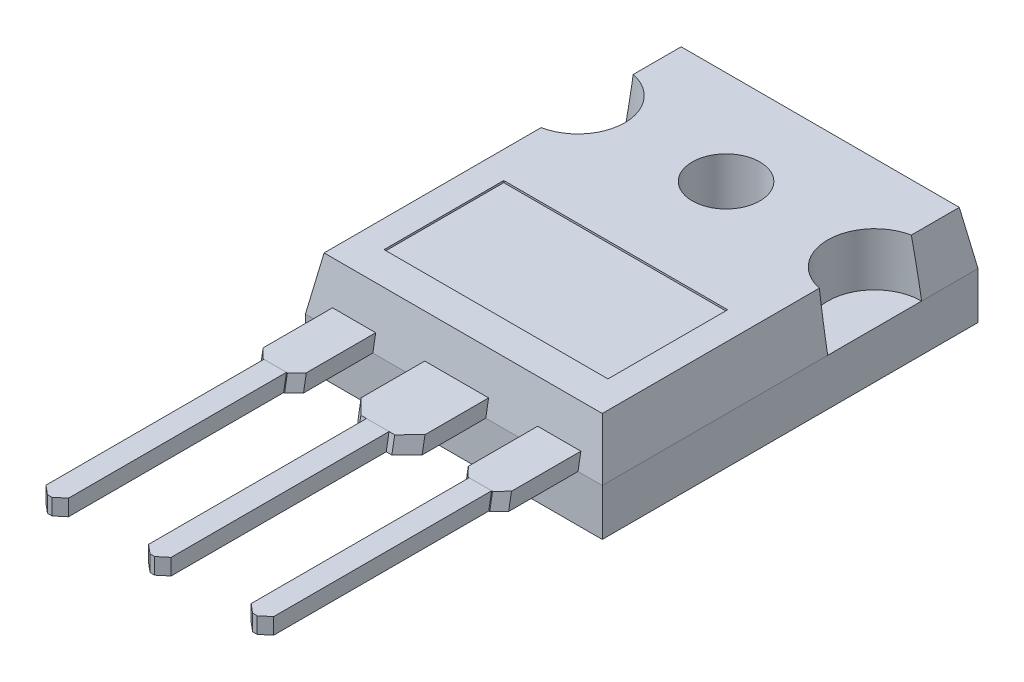
from build123d import *
from OCP.BRepFilletAPI import BRepFilletAPI_MakeChamfer

# Parameters (mm, degrees)
SKETCH1_W             = 15.8
SKETCH1_H             = 20
BOSS_EXTRUDE1_DEPTH   = 2.49
SKETCH2_W             = 15.8
SKETCH2_H             = 20
BOSS_EXTRUDE3_DEPTH   = 2.82
BOSS_EXTRUDE3_TAPER   = 10
BOSS_EXTRUDE4_START   = -1.7
BOSS_EXTRUDE4_DEPTH   = 3.4
BOSS_EXTRUDE4_START_2 = -6.61
BOSS_EXTRUDE4_2_DEPTH = 2.3
BOSS_EXTRUDE4_START_3 = 4.31
BOSS_EXTRUDE4_3_DEPTH = 2.3
BOSS_EXTRUDE6_START   = 14.04836
SKETCH5_W             = 1.2
SKETCH5_H             = 0.86
BOSS_EXTRUDE6_DEPTH   = 12
BOSS_EXTRUDE6_2_DEPTH = 12
BOSS_EXTRUDE6_3_DEPTH = 12
SKETCH6_R             = 1.8
CUT_EXTRUDE1_DEPTH    = 28.733069795
SKETCH7_R             = 2.5
CUT_EXTRUDE2_DEPTH    = 2.82
CHAMFER2_SIZE         = 0.5
CHAMFER3_SIZE         = 0.8
CHAMFER7_SIZE         = 0.4
CHAMFER7_SIZE2        = 0.476701437
CHAMFER8_SIZE         = 0.4
CHAMFER8_SIZE2        = 0.476701437
CHAMFER9_SIZE         = 0.4
CHAMFER9_SIZE2        = 0.476701437
SKETCH9_W             = 12.986336946
SKETCH9_H             = 15.440559179
CUT_EXTRUDE3_DEPTH    = 2.49
SKETCH10_W            = 12.986336946
SKETCH10_H            = 15.440559179
BOSS_EXTRUDE7_DEPTH   = 2.49
SKETCH13_R            = 1.8
CUT_EXTRUDE4_DEPTH    = 2.49
SKETCH14_W            = 11.919281888
SKETCH14_H            = 6.372610916
CUT_EXTRUDE5_DEPTH    = 0.1


# Read off the part's stored shape, not the designer's step: Boss-Extrude4
with BuildPart() as part:
    # Sketch1 → Boss-Extrude1 (new body)
    with BuildSketch(Plane(origin=(0, 0, 0), x_dir=(1, 0, 0), z_dir=(0, 1, 0))):
        Rectangle(SKETCH1_W, SKETCH1_H)
    extrude(amount=BOSS_EXTRUDE1_DEPTH)

    # Sketch2 → Boss-Extrude3 (add)
    with BuildSketch(Plane(origin=(0, 2.49, 0), x_dir=(1, 0, 0), z_dir=(0, 1, 0))):
        Rectangle(SKETCH2_W, SKETCH2_H)
    extrude(amount=BOSS_EXTRUDE3_DEPTH, taper=BOSS_EXTRUDE3_TAPER)

    # Boss-Extrude4 outline → Boss-Extrude4 (add)
    with BuildSketch(Plane.YZ.offset(BOSS_EXTRUDE4_START)):
        Polygon((2.49, 10), (3.35, 9.848358796), (3.35, 14.048358797), (2.49, 14.2), align=None)
    extrude(amount=BOSS_EXTRUDE4_DEPTH)

    # Boss-Extrude4 2 outline → Boss-Extrude4 2 (add)
    with BuildSketch(Plane.YZ.offset(BOSS_EXTRUDE4_START_2)):
        Polygon((2.49, 10), (3.35, 9.848358796), (3.35, 14.048358797), (2.49, 14.2), align=None)
    extrude(amount=BOSS_EXTRUDE4_2_DEPTH)

    # Boss-Extrude4 3 outline → Boss-Extrude4 3 (add)
    with BuildSketch(Plane.YZ.offset(BOSS_EXTRUDE4_START_3)):
        Polygon((2.49, 10), (3.35, 9.848358796), (3.35, 14.048358797), (2.49, 14.2), align=None)
    extrude(amount=BOSS_EXTRUDE4_3_DEPTH)

    # Sketch6 → Cut-Extrude1 (cut, through all)
    with BuildSketch(Plane(origin=(0, 5.31, 0), x_dir=(1, 0, 0), z_dir=(0, 1, 0))):
        with Locations(Location((0, 4.49, 0), (0, 0, 270))):
            Circle(SKETCH6_R)
    extrude(amount=-CUT_EXTRUDE1_DEPTH, mode=Mode.SUBTRACT)

    # Sketch7 → Cut-Extrude2 (cut)
    with BuildSketch(Plane(origin=(0, 5.31, 0), x_dir=(1, 0, 0), z_dir=(0, 1, 0))):
        with Locations((7.9, 4.5)):
            Circle(SKETCH7_R)
        with Locations((-7.9, 4.5)):
            Circle(SKETCH7_R)
    extrude(amount=-CUT_EXTRUDE2_DEPTH, mode=Mode.SUBTRACT)

    # Chamfer2
    chamfer2_edges = [part.edges().sort_by_distance(p)[0] for p in [
        (4.31, 2.92, 14.124179399),
        (6.61, 2.92, 14.124179399),
        (-4.31, 2.92, 14.124179399),
        (-6.61, 2.92, 14.124179399),
    ]]
    chamfer(chamfer2_edges, length=CHAMFER2_SIZE)

    # Chamfer3
    chamfer3_edges = [part.edges().sort_by_distance(p)[0] for p in [
        (1.7, 2.92, 14.124179399),
        (-1.7, 2.92, 14.124179399),
    ]]
    chamfer(chamfer3_edges, length=CHAMFER3_SIZE)

    # Sketch9 → Cut-Extrude3 (cut)
    with BuildSketch(Plane.XZ):
        with Locations((0, -0.672147613)):
            Rectangle(SKETCH9_W, SKETCH9_H)
    extrude(amount=-CUT_EXTRUDE3_DEPTH, mode=Mode.SUBTRACT)

    # Sketch10 → Boss-Extrude7 (add)
    with BuildSketch(Plane.XZ.offset(-2.49)):
        with Locations((0, -0.672147613)):
            Rectangle(SKETCH10_W, SKETCH10_H)
    extrude(amount=BOSS_EXTRUDE7_DEPTH)

    # Sketch13 → Cut-Extrude4 (cut)
    with BuildSketch(Plane(origin=(0, 2.49, 0), x_dir=(1, 0, 0), z_dir=(0, 1, 0))):
        with Locations(Location((0, 4.49, 0), (0, 0, 270))):
            Circle(SKETCH13_R)
    extrude(amount=-CUT_EXTRUDE4_DEPTH, mode=Mode.SUBTRACT)

    # Sketch14 → Cut-Extrude5 (cut)
    with BuildSketch(Plane(origin=(0, 5.31, 0), x_dir=(1, 0, 0), z_dir=(0, 1, 0))):
        with Locations((0, -4.569573217)):
            Rectangle(SKETCH14_W, SKETCH14_H)
    extrude(amount=-CUT_EXTRUDE5_DEPTH, mode=Mode.SUBTRACT)


with BuildPart() as body_2:
    # Sketch5 → Boss-Extrude6 (new body)
    with BuildSketch(Plane.XY.offset(BOSS_EXTRUDE6_START)):
        with Locations((0, 2.92)):
            Rectangle(SKETCH5_W, SKETCH5_H)
    extrude(amount=BOSS_EXTRUDE6_DEPTH)

    # Chamfer7: one chamfer whose edges measure the first distance from different faces: ONE call of the kernel's chamfer builder (chamfer() names one face for all edges)
    chamfer7_edges_1 = [body_2.edges().sort_by_distance(p)[0] for p in [
        (-0.6, 2.92, 26.04836),
    ]]
    chamfer7_side_1 = [body_2.faces().sort_by_distance(p)[0] for p in [
        (-0.6, 2.92, 20.04836),
    ]]
    chamfer7_edges_2 = [body_2.edges().sort_by_distance(p)[0] for p in [
        (0.6, 2.92, 26.04836),
    ]]
    chamfer7_side_2 = [body_2.faces().sort_by_distance(p)[0] for p in [
        (0.6, 2.92, 20.04836),
    ]]
    chamfer7 = BRepFilletAPI_MakeChamfer(body_2.part.solid().wrapped)
    for e in chamfer7_edges_1:
        chamfer7.Add(CHAMFER7_SIZE, CHAMFER7_SIZE2, e.wrapped, chamfer7_side_1[0].wrapped)  # the first distance lies on this face
    for e in chamfer7_edges_2:
        chamfer7.Add(CHAMFER7_SIZE, CHAMFER7_SIZE2, e.wrapped, chamfer7_side_2[0].wrapped)  # the first distance lies on this face
    add(Compound.cast(chamfer7.Shape()), mode=Mode.REPLACE)


with BuildPart() as body_3:
    # Sketch5 → Boss-Extrude6 2 (new body)
    with BuildSketch(Plane.XY.offset(BOSS_EXTRUDE6_START)):
        with Locations((5.46, 2.92)):
            Rectangle(SKETCH5_W, SKETCH5_H)
    extrude(amount=BOSS_EXTRUDE6_2_DEPTH)

    # Chamfer9: one chamfer whose edges measure the first distance from different faces: ONE call of the kernel's chamfer builder (chamfer() names one face for all edges)
    chamfer9_edges_1 = [body_3.edges().sort_by_distance(p)[0] for p in [
        (4.86, 2.92, 26.04836),
    ]]
    chamfer9_side_1 = [body_3.faces().sort_by_distance(p)[0] for p in [
        (4.86, 2.92, 20.04836),
    ]]
    chamfer9_edges_2 = [body_3.edges().sort_by_distance(p)[0] for p in [
        (6.06, 2.92, 26.04836),
    ]]
    chamfer9_side_2 = [body_3.faces().sort_by_distance(p)[0] for p in [
        (6.06, 2.92, 20.04836),
    ]]
    chamfer9 = BRepFilletAPI_MakeChamfer(body_3.part.solid().wrapped)
    for e in chamfer9_edges_1:
        chamfer9.Add(CHAMFER9_SIZE, CHAMFER9_SIZE2, e.wrapped, chamfer9_side_1[0].wrapped)  # the first distance lies on this face
    for e in chamfer9_edges_2:
        chamfer9.Add(CHAMFER9_SIZE, CHAMFER9_SIZE2, e.wrapped, chamfer9_side_2[0].wrapped)  # the first distance lies on this face
    add(Compound.cast(chamfer9.Shape()), mode=Mode.REPLACE)


with BuildPart() as body_4:
    # Sketch5 → Boss-Extrude6 3 (new body)
    with BuildSketch(Plane.XY.offset(BOSS_EXTRUDE6_START)):
        with Locations((-5.46, 2.92)):
            Rectangle(SKETCH5_W, SKETCH5_H)
    extrude(amount=BOSS_EXTRUDE6_3_DEPTH)

    # Chamfer8: one chamfer whose edges measure the first distance from different faces: ONE call of the kernel's chamfer builder (chamfer() names one face for all edges)
    chamfer8_edges_1 = [body_4.edges().sort_by_distance(p)[0] for p in [
        (-4.86, 2.92, 26.04836),
    ]]
    chamfer8_side_1 = [body_4.faces().sort_by_distance(p)[0] for p in [
        (-4.86, 2.92, 20.04836),
    ]]
    chamfer8_edges_2 = [body_4.edges().sort_by_distance(p)[0] for p in [
        (-6.06, 2.92, 26.04836),
    ]]
    chamfer8_side_2 = [body_4.faces().sort_by_distance(p)[0] for p in [
        (-6.06, 2.92, 20.04836),
    ]]
    chamfer8 = BRepFilletAPI_MakeChamfer(body_4.part.solid().wrapped)
    for e in chamfer8_edges_1:
        chamfer8.Add(CHAMFER8_SIZE, CHAMFER8_SIZE2, e.wrapped, chamfer8_side_1[0].wrapped)  # the first distance lies on this face
    for e in chamfer8_edges_2:
        chamfer8.Add(CHAMFER8_SIZE, CHAMFER8_SIZE2, e.wrapped, chamfer8_side_2[0].wrapped)  # the first distance lies on this face
    add(Compound.cast(chamfer8.Shape()), mode=Mode.REPLACE)


solid = Compound([part.part, body_2.part, body_3.part, body_4.part])
